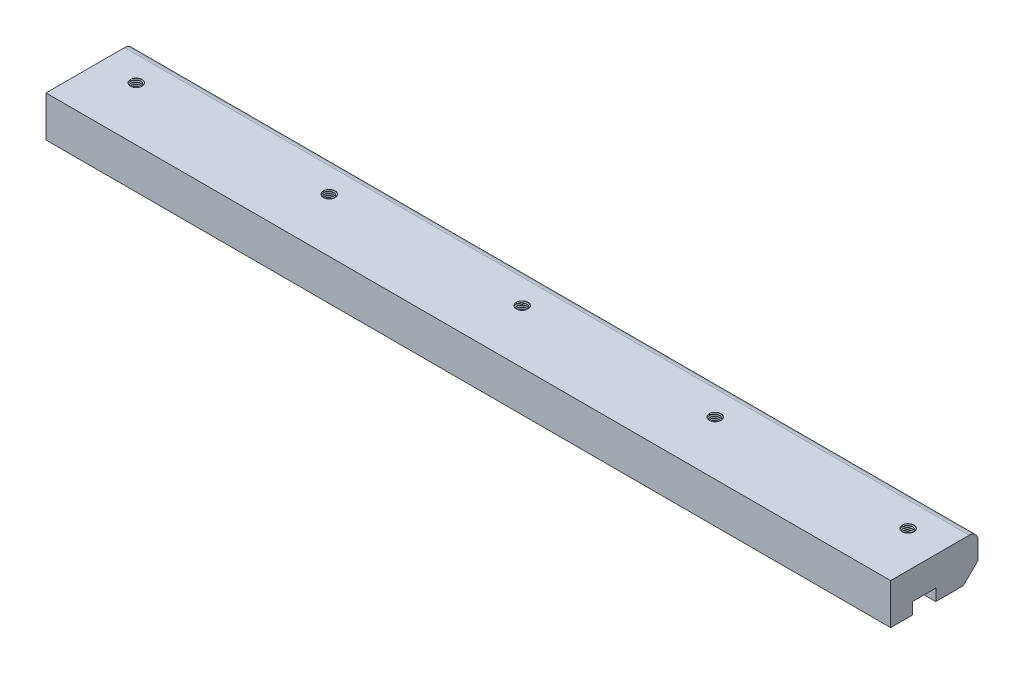
from build123d import *
from build123d.topology import SkipClean

# Parameters (mm, degrees)
SALIENTE_EXTRUIR1_DEPTH = 580
CROQUIS2_R              = 4.026765968
CORTAR_EXTRUIR1_DEPTH   = 10
ROSCA1_PITCH            = 1.25
ROSCA2_PITCH            = 1.25
ROSCA3_PITCH            = 1.25
ROSCA4_PITCH            = 1.25
ROSCA5_PITCH            = 1.25


with BuildPart() as part:
    # Croquis1 → Saliente-Extruir1 (new body)
    with BuildSketch(Plane(origin=(0, 0, 0), x_dir=(0, 0, -1), z_dir=(1, 0, 0))):
        with BuildLine():
            Line((0, 0), (15, 0))
            Line((15, 0), (15, 8))
            Line((15, 8), (31, 8))
            Line((31, 8), (31, 0))
            Line((31, 0), (50, 0))
            Line((50, 0), (60, 10))
            Line((60, 10), (60, 22))
            ThreePointArc((60, 22), (58.242640687, 26.242640687), (54, 28))
            Line((54, 28), (0, 28))
            Line((0, 28), (0, 0))
        make_face()
    extrude(amount=SALIENTE_EXTRUIR1_DEPTH)

    # Croquis2 → Cortar-Extruir1 (cut)
    with BuildSketch(Plane(origin=(0, 28, 0), x_dir=(1, 0, 0), z_dir=(0, 1, 0))):
        with Locations(Location((25, 37, 0), (0, 0, 270))):
            Circle(CROQUIS2_R)
        with Locations(Location((157.5, 37, 0), (0, 0, 270))):
            Circle(CROQUIS2_R)
        with Locations(Location((290, 37, 0), (0, 0, 270))):
            Circle(CROQUIS2_R)
        with Locations(Location((422.5, 37, 0), (0, 0, 270))):
            Circle(CROQUIS2_R)
        with Locations(Location((555, 37, 0), (0, 0, 270))):
            Circle(CROQUIS2_R)
    extrude(amount=-CORTAR_EXTRUIR1_DEPTH, mode=Mode.SUBTRACT)

    # Rosca1: the profile of Perfil de rosca1 profile screwed along a right-hand helix of 8 turns, 8 arcs to a turn; built about Z, then put on its axis
    rosca1_z = Axis((0, 0, 0), (0, 0, 1))
    rosca1_corners = [(4.027065968, 0, -0.000173205), (4.027065968, 0, 1.093923202), (3.350183624, 0, 0.703124998), (3.350183624, 0, 0.390624998)]
    with BuildLine(mode=Mode.PRIVATE) as rosca1_profile:
        Line(rosca1_corners[0], rosca1_corners[1])
        Line(rosca1_corners[1], rosca1_corners[2])
        Line(rosca1_corners[2], rosca1_corners[3])
        Line(rosca1_corners[3], rosca1_corners[0])
    rosca1_cap = Face(rosca1_profile.wire())
    rosca1_turn_angles = [0, 22.5, 45, 67.5, 90, 112.5, 135, 157.5, 180, 202.5, 225, 247.5, 270, 292.5, 315, 337.5, 360]
    rosca1_turn_weights = [1, 0.9238795325112867, 1, 0.9238795325112867, 1, 0.9238795325112867, 1, 0.9238795325112867, 1, 0.9238795325112867, 1, 0.9238795325112867, 1, 0.9238795325112867, 1, 0.9238795325112867, 1]
    rosca1_turn_rails = [Edge.make_bspline([Vector(p[0], p[1], 0).rotate(rosca1_z, rosca1_turn_angles[k]) / rosca1_turn_weights[k] + Vector(0, 0, p[2] + ROSCA1_PITCH * rosca1_turn_angles[k] / 360) for k in range(17)], [0, 0, 0, 1, 1, 2, 2, 3, 3, 4, 4, 5, 5, 6, 6, 7, 7, 8, 8, 8], 2, rosca1_turn_weights) for p in rosca1_corners]
    rosca1_turn_sides = [Face.make_surface_from_curves(rosca1_turn_rails[p[0]], rosca1_turn_rails[p[1]]) for p in [(0, 1), (1, 2), (2, 3), (3, 0)]]
    rosca1 = Plane(origin=(555, 28, -37), x_dir=(-1, 0, 0), z_dir=(0, -1, 0)) * Solid(Shell([*[p.moved(Location((0, 0, ROSCA1_PITCH * i))) for i in range(8) for p in rosca1_turn_sides], rosca1_cap, rosca1_cap.rotate(rosca1_z, 2880).moved(Location((0, 0, ROSCA1_PITCH * 2880 / 360)))]))
    add(rosca1)

    # Rosca2: the profile of Perfil de rosca2 profile screwed along a right-hand helix of 8 turns, 8 arcs to a turn; built about Z, then put on its axis
    with SkipClean():  # the faces are left unmerged after this step: merging them gives an invalid solid
        rosca2_z = Axis((0, 0, 0), (0, 0, 1))
        rosca2_corners = [(4.027065968, 0, -0.000173205), (4.027065968, 0, 1.093923202), (3.350183624, 0, 0.703124998), (3.350183624, 0, 0.390624998)]
        with BuildLine(mode=Mode.PRIVATE) as rosca2_profile:
            Line(rosca2_corners[0], rosca2_corners[1])
            Line(rosca2_corners[1], rosca2_corners[2])
            Line(rosca2_corners[2], rosca2_corners[3])
            Line(rosca2_corners[3], rosca2_corners[0])
        rosca2_cap = Face(rosca2_profile.wire())
        rosca2_turn_angles = [0, 22.5, 45, 67.5, 90, 112.5, 135, 157.5, 180, 202.5, 225, 247.5, 270, 292.5, 315, 337.5, 360]
        rosca2_turn_weights = [1, 0.9238795325112867, 1, 0.9238795325112867, 1, 0.9238795325112867, 1, 0.9238795325112867, 1, 0.9238795325112867, 1, 0.9238795325112867, 1, 0.9238795325112867, 1, 0.9238795325112867, 1]
        rosca2_turn_rails = [Edge.make_bspline([Vector(p[0], p[1], 0).rotate(rosca2_z, rosca2_turn_angles[k]) / rosca2_turn_weights[k] + Vector(0, 0, p[2] + ROSCA2_PITCH * rosca2_turn_angles[k] / 360) for k in range(17)], [0, 0, 0, 1, 1, 2, 2, 3, 3, 4, 4, 5, 5, 6, 6, 7, 7, 8, 8, 8], 2, rosca2_turn_weights) for p in rosca2_corners]
        rosca2_turn_sides = [Face.make_surface_from_curves(rosca2_turn_rails[p[0]], rosca2_turn_rails[p[1]]) for p in [(0, 1), (1, 2), (2, 3), (3, 0)]]
        rosca2 = Plane(origin=(422.5, 28, -37), x_dir=(-1, 0, 0), z_dir=(0, -1, 0)) * Solid(Shell([*[p.moved(Location((0, 0, ROSCA2_PITCH * i))) for i in range(8) for p in rosca2_turn_sides], rosca2_cap, rosca2_cap.rotate(rosca2_z, 2880).moved(Location((0, 0, ROSCA2_PITCH * 2880 / 360)))]))
        add(rosca2)

    # Rosca3: the profile of Perfil de rosca3 profile screwed along a right-hand helix of 8 turns, 8 arcs to a turn; built about Z, then put on its axis
    with SkipClean():  # the faces are left unmerged after this step: merging them gives an invalid solid
        rosca3_z = Axis((0, 0, 0), (0, 0, 1))
        rosca3_corners = [(4.027065968, 0, -0.000173205), (4.027065968, 0, 1.093923202), (3.350183624, 0, 0.703124998), (3.350183624, 0, 0.390624998)]
        with BuildLine(mode=Mode.PRIVATE) as rosca3_profile:
            Line(rosca3_corners[0], rosca3_corners[1])
            Line(rosca3_corners[1], rosca3_corners[2])
            Line(rosca3_corners[2], rosca3_corners[3])
            Line(rosca3_corners[3], rosca3_corners[0])
        rosca3_cap = Face(rosca3_profile.wire())
        rosca3_turn_angles = [0, 22.5, 45, 67.5, 90, 112.5, 135, 157.5, 180, 202.5, 225, 247.5, 270, 292.5, 315, 337.5, 360]
        rosca3_turn_weights = [1, 0.9238795325112867, 1, 0.9238795325112867, 1, 0.9238795325112867, 1, 0.9238795325112867, 1, 0.9238795325112867, 1, 0.9238795325112867, 1, 0.9238795325112867, 1, 0.9238795325112867, 1]
        rosca3_turn_rails = [Edge.make_bspline([Vector(p[0], p[1], 0).rotate(rosca3_z, rosca3_turn_angles[k]) / rosca3_turn_weights[k] + Vector(0, 0, p[2] + ROSCA3_PITCH * rosca3_turn_angles[k] / 360) for k in range(17)], [0, 0, 0, 1, 1, 2, 2, 3, 3, 4, 4, 5, 5, 6, 6, 7, 7, 8, 8, 8], 2, rosca3_turn_weights) for p in rosca3_corners]
        rosca3_turn_sides = [Face.make_surface_from_curves(rosca3_turn_rails[p[0]], rosca3_turn_rails[p[1]]) for p in [(0, 1), (1, 2), (2, 3), (3, 0)]]
        rosca3 = Plane(origin=(290, 28, -37), x_dir=(-1, 0, 0), z_dir=(0, -1, 0)) * Solid(Shell([*[p.moved(Location((0, 0, ROSCA3_PITCH * i))) for i in range(8) for p in rosca3_turn_sides], rosca3_cap, rosca3_cap.rotate(rosca3_z, 2880).moved(Location((0, 0, ROSCA3_PITCH * 2880 / 360)))]))
        add(rosca3)

    # Rosca4: the profile of Perfil de rosca4 profile screwed along a right-hand helix of 8 turns, 8 arcs to a turn; built about Z, then put on its axis
    with SkipClean():  # the faces are left unmerged after this step: merging them gives an invalid solid
        rosca4_z = Axis((0, 0, 0), (0, 0, 1))
        rosca4_corners = [(4.027065968, 0, -0.000173205), (4.027065968, 0, 1.093923202), (3.350183624, 0, 0.703124998), (3.350183624, 0, 0.390624998)]
        with BuildLine(mode=Mode.PRIVATE) as rosca4_profile:
            Line(rosca4_corners[0], rosca4_corners[1])
            Line(rosca4_corners[1], rosca4_corners[2])
            Line(rosca4_corners[2], rosca4_corners[3])
            Line(rosca4_corners[3], rosca4_corners[0])
        rosca4_cap = Face(rosca4_profile.wire())
        rosca4_turn_angles = [0, 22.5, 45, 67.5, 90, 112.5, 135, 157.5, 180, 202.5, 225, 247.5, 270, 292.5, 315, 337.5, 360]
        rosca4_turn_weights = [1, 0.9238795325112867, 1, 0.9238795325112867, 1, 0.9238795325112867, 1, 0.9238795325112867, 1, 0.9238795325112867, 1, 0.9238795325112867, 1, 0.9238795325112867, 1, 0.9238795325112867, 1]
        rosca4_turn_rails = [Edge.make_bspline([Vector(p[0], p[1], 0).rotate(rosca4_z, rosca4_turn_angles[k]) / rosca4_turn_weights[k] + Vector(0, 0, p[2] + ROSCA4_PITCH * rosca4_turn_angles[k] / 360) for k in range(17)], [0, 0, 0, 1, 1, 2, 2, 3, 3, 4, 4, 5, 5, 6, 6, 7, 7, 8, 8, 8], 2, rosca4_turn_weights) for p in rosca4_corners]
        rosca4_turn_sides = [Face.make_surface_from_curves(rosca4_turn_rails[p[0]], rosca4_turn_rails[p[1]]) for p in [(0, 1), (1, 2), (2, 3), (3, 0)]]
        rosca4 = Plane(origin=(157.5, 28, -37), x_dir=(-1, 0, 0), z_dir=(0, -1, 0)) * Solid(Shell([*[p.moved(Location((0, 0, ROSCA4_PITCH * i))) for i in range(8) for p in rosca4_turn_sides], rosca4_cap, rosca4_cap.rotate(rosca4_z, 2880).moved(Location((0, 0, ROSCA4_PITCH * 2880 / 360)))]))
        add(rosca4)

    # Rosca5: the profile of Perfil de rosca5 profile screwed along a right-hand helix of 8 turns, 8 arcs to a turn; built about Z, then put on its axis
    with SkipClean():  # the faces are left unmerged after this step: merging them gives an invalid solid
        rosca5_z = Axis((0, 0, 0), (0, 0, 1))
        rosca5_corners = [(4.027065968, 0, -0.000173205), (4.027065968, 0, 1.093923202), (3.350183624, 0, 0.703124998), (3.350183624, 0, 0.390624998)]
        with BuildLine(mode=Mode.PRIVATE) as rosca5_profile:
            Line(rosca5_corners[0], rosca5_corners[1])
            Line(rosca5_corners[1], rosca5_corners[2])
            Line(rosca5_corners[2], rosca5_corners[3])
            Line(rosca5_corners[3], rosca5_corners[0])
        rosca5_cap = Face(rosca5_profile.wire())
        rosca5_turn_angles = [0, 22.5, 45, 67.5, 90, 112.5, 135, 157.5, 180, 202.5, 225, 247.5, 270, 292.5, 315, 337.5, 360]
        rosca5_turn_weights = [1, 0.9238795325112867, 1, 0.9238795325112867, 1, 0.9238795325112867, 1, 0.9238795325112867, 1, 0.9238795325112867, 1, 0.9238795325112867, 1, 0.9238795325112867, 1, 0.9238795325112867, 1]
        rosca5_turn_rails = [Edge.make_bspline([Vector(p[0], p[1], 0).rotate(rosca5_z, rosca5_turn_angles[k]) / rosca5_turn_weights[k] + Vector(0, 0, p[2] + ROSCA5_PITCH * rosca5_turn_angles[k] / 360) for k in range(17)], [0, 0, 0, 1, 1, 2, 2, 3, 3, 4, 4, 5, 5, 6, 6, 7, 7, 8, 8, 8], 2, rosca5_turn_weights) for p in rosca5_corners]
        rosca5_turn_sides = [Face.make_surface_from_curves(rosca5_turn_rails[p[0]], rosca5_turn_rails[p[1]]) for p in [(0, 1), (1, 2), (2, 3), (3, 0)]]
        rosca5 = Plane(origin=(25, 28, -37), x_dir=(-1, 0, 0), z_dir=(0, -1, 0)) * Solid(Shell([*[p.moved(Location((0, 0, ROSCA5_PITCH * i))) for i in range(8) for p in rosca5_turn_sides], rosca5_cap, rosca5_cap.rotate(rosca5_z, 2880).moved(Location((0, 0, ROSCA5_PITCH * 2880 / 360)))]))
        add(rosca5)


solid = part.part
